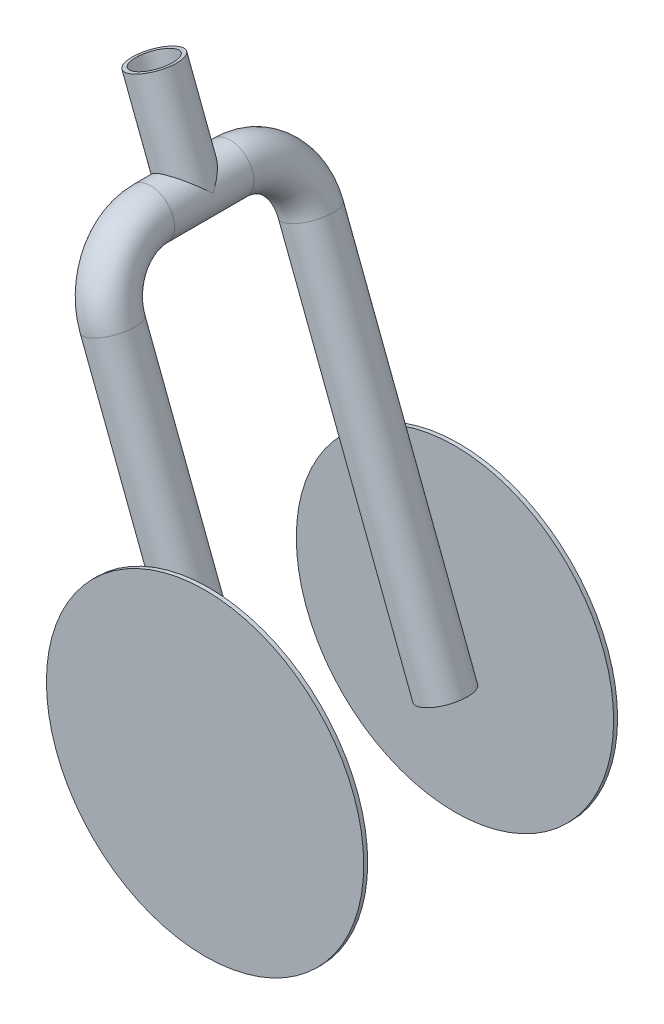
from build123d import *

# Parameters (mm, degrees)
SWEEP_THIN1_PROFILE_R   = 12
SWEEP_THIN1_PROFILE_R_2 = 10
THICKEN1_START          = -64
THICKEN1_OUTLINE_R      = 80
THICKEN1_DEPTH          = 2
THICKEN2_START          = 62
THICKEN2_OUTLINE_R      = 80
THICKEN2_DEPTH          = 2


# Read off the part's stored shape, not the designer's step: Thicken1, Thicken2
with BuildPart() as part:
    # Sweep-Thin1: sweep along a path in Sketch2
    with BuildLine(Plane(origin=(400.0000000000001, -300, 0), x_dir=(0, 0, -1), z_dir=(0.934155191329314, 0.35686703197758807, 0))) as sweep_thin1_path:
        Line((-3.67e-15, 251.14578261144848), (2.59e-15, 200.0000000000001))
        Line((2.59e-15, 200.0000000000001), (-20.000000000000004, 200.0000000000001))
        ThreePointArc((-20.000000000000004, 200.0000000000001), (-41.21320343559641, 191.21320343559654), (-49.999999999999986, 170.0000000000001))
        Line((-49.999999999999986, 170.0000000000001), (-49.99999999999998, -19.99999999999988))
    # Sweep-Thin1 profile (on start of the path) → Sweep-Thin1 (sweep)
    with BuildSketch(Plane(origin=(310.37434996576394, -65.39086339305203, 3.67e-15), x_dir=(-0.934155191329314, -0.35686703197758807, 0), z_dir=(0.35686703197758807, -0.934155191329314, 0))):
        Circle(SWEEP_THIN1_PROFILE_R)
        Circle(SWEEP_THIN1_PROFILE_R_2, mode=Mode.SUBTRACT)
    sweep_thin1 = sweep(path=sweep_thin1_path.line, transition=Transition.RIGHT)

    # Mirror1: Sweep-Thin1 across plane
    add(sweep_thin1.mirror(Plane.XY))


with BuildPart() as body_2:
    # Thicken1 outline → Thicken1 (new body)
    with BuildSketch(Plane.XY.offset(THICKEN1_START)):
        with Locations((400, -300)):
            Circle(THICKEN1_OUTLINE_R)
    extrude(amount=THICKEN1_DEPTH)


with BuildPart() as body_3:
    # Thicken2 outline → Thicken2 (new body)
    with BuildSketch(Plane.XY.offset(THICKEN2_START)):
        with Locations((400, -300)):
            Circle(THICKEN2_OUTLINE_R)
    extrude(amount=THICKEN2_DEPTH)


solid = Compound([part.part, body_2.part, body_3.part])
